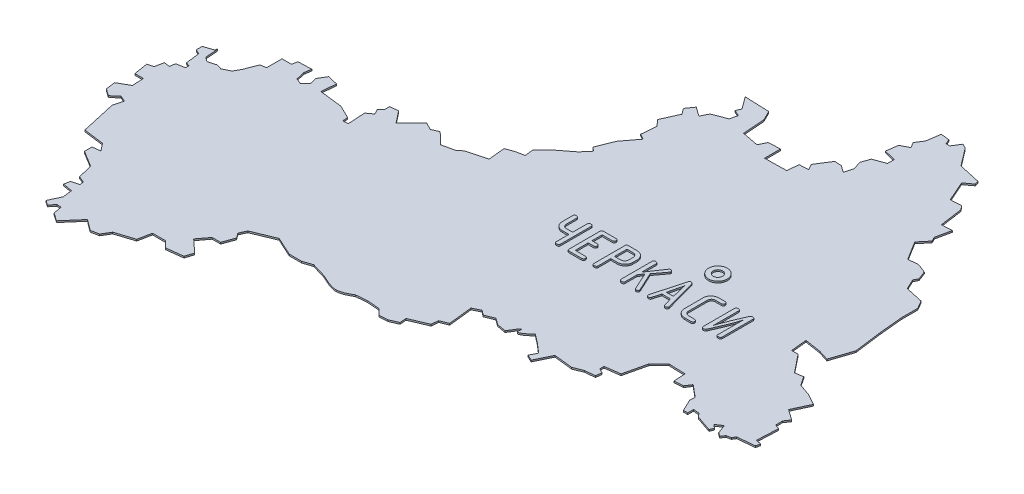
from build123d import *

# Parameters (mm, degrees)
EXTRUDE_1_DEPTH = 5
SKETCH_2_R      = 30
SKETCH_2_R_2    = 15
EXTRUDE_2_DEPTH = 10
SCALE_1_SCALE   = 0.05


with BuildPart() as part:
    # Эскиз1 → Бобышка-Вытянуть1 (new body)
    with BuildSketch(Plane(origin=(0, 0, 0), x_dir=(1, 0, 0), z_dir=(0, 1, 0))):
        with BuildLine():
            Line((-10045.36726, 2871.76464), (-10031.095, 2888.60992))
            Line((-10031.095, 2888.60992), (-10017.45774, 2887.3069))
            Line((-10017.45774, 2887.3069), (-10012.25836, 2860.07048))
            Line((-10012.25836, 2860.07048), (-9986.97012, 2842.54194))
            Line((-9986.97012, 2842.54194), (-9940.8869, 2895.76764))
            Line((-9940.8869, 2895.76764), (-9906.50546, 2869.80122))
            Line((-9906.50546, 2869.80122), (-9881.18166, 2874.99044))
            Line((-9881.18166, 2874.99044), (-9865.60384, 2900.95686))
            Line((-9865.60384, 2900.95686), (-9807.21686, 2919.74524))
            Line((-9807.21686, 2919.74524), (-9798.77136, 2961.9575))
            Line((-9798.77136, 2961.9575), (-9756.5718, 2961.9575))
            Line((-9756.5718, 2961.9575), (-9737.77326, 2941.8534))
            Line((-9737.77326, 2941.8534), (-9684.56534, 2948.33802))
            Line((-9684.56534, 2948.33802), (-9676.12492, 2974.29174))
            Line((-9676.12492, 2974.29174), (-9716.9986, 3011.92692))
            Line((-9716.9986, 3011.92692), (-9691.69512, 3045.64288))
            Line((-9691.69512, 3045.64288), (-9664.446, 3045.64288))
            Line((-9664.446, 3045.64288), (-9650.82652, 3083.306))
            Line((-9650.82652, 3083.306), (-9662.4902, 3098.88636))
            Line((-9662.4902, 3098.88636), (-9652.1143, 3120.9488))
            Line((-9652.1143, 3120.9488), (-9581.37022, 3150.15118))
            Line((-9581.37022, 3150.15118), (-9521.70054, 3122.8919))
            Line((-9521.70054, 3122.8919), (-9482.08924, 3122.8919))
            Line((-9482.08924, 3122.8919), (-9452.8894, 3132.6328))
            Line((-9452.8894, 3132.6328), (-9406.79094, 3118.99808))
            add(Edge.make_bspline(
                [(-9406.79094, 3118.99808), (-9362.7067, 3096.94326), (-9345.8284, 3098.88636)],
                knots=[0.100401606, 0.100401606, 0.100401606, 0.104417671, 0.104417671, 0.104417671], degree=2))
            add(Edge.make_bspline(
                [(-9345.8284, 3098.88636), (-9328.29224, 3100.17668), (-9303.004, 3115.74434)],
                knots=[0.104417671, 0.104417671, 0.104417671, 0.108433735, 0.108433735, 0.108433735], degree=2))
            Line((-9303.004, 3115.74434), (-9267.29414, 3118.99808))
            Line((-9267.29414, 3118.99808), (-9226.42808, 3115.74434))
            Line((-9226.42808, 3115.74434), (-9207.57112, 3096.94326))
            Line((-9207.57112, 3096.94326), (-9181.62502, 3098.88636))
            Line((-9181.62502, 3098.88636), (-9154.38352, 3110.5983))
            Line((-9154.38352, 3110.5983), (-9156.33678, 3131.3247))
            Line((-9156.33678, 3131.3247), (-9099.87004, 3155.3404))
            Line((-9099.87004, 3155.3404), (-9097.899, 3177.4003))
            Line((-9097.899, 3177.4003), (-9072.60314, 3187.79906))
            Line((-9072.60314, 3187.79906), (-9081.0461, 3264.36228))
            Line((-9081.0461, 3264.36228), (-9057.03548, 3276.04882))
            Line((-9057.03548, 3276.04882), (-9042.07996, 3264.36228))
            Line((-9042.07996, 3264.36228), (-9012.90552, 3276.04882))
            Line((-9012.90552, 3276.04882), (-8992.15118, 3261.11616))
            Line((-8992.15118, 3261.11616), (-8963.58888, 3255.93202))
            add(Edge.make_bspline(
                [(-8963.58888, 3255.93202), (-8937.625, 3300.06452), (-8940.87112, 3279.92994)],
                knots=[0.168674699, 0.168674699, 0.168674699, 0.172690763, 0.172690763, 0.172690763], degree=2))
            add(Edge.make_bspline(
                [(-8940.87112, 3279.92994), (-8944.74716, 3259.17814), (-8905.20444, 3294.8753)],
                knots=[0.172690763, 0.172690763, 0.172690763, 0.176706827, 0.176706827, 0.176706827], degree=2))
            Line((-8905.20444, 3294.8753), (-8876.63452, 3272.79762))
            Line((-8876.63452, 3272.79762), (-8847.43468, 3247.49668))
            Line((-8847.43468, 3247.49668), (-8859.11614, 3224.784))
            Line((-8859.11614, 3224.784), (-8840.28458, 3216.34358))
            Line((-8840.28458, 3216.34358), (-8815.00396, 3267.61348))
            Line((-8815.00396, 3267.61348), (-8755.2911, 3261.11616))
            Line((-8755.2911, 3261.11616), (-8726.06332, 3272.79762))
            Line((-8726.06332, 3272.79762), (-8693.6326, 3276.04882))
            Line((-8693.6326, 3276.04882), (-8691.67426, 3294.8753))
            Line((-8691.67426, 3294.8753), (-8705.93636, 3301.99492))
            Line((-8705.93636, 3301.99492), (-8705.93636, 3315.6398))
            Line((-8705.93636, 3315.6398), (-8657.93036, 3322.10664))
            Line((-8657.93036, 3322.10664), (-8641.06984, 3394.1512))
            Line((-8641.06984, 3394.1512), (-8608.6315, 3426.57938))
            Line((-8608.6315, 3426.57938), (-8555.41088, 3424.65406))
            Line((-8555.41088, 3424.65406), (-8553.46016, 3387.00872))
            Line((-8553.46016, 3387.00872), (-8524.91564, 3388.95182))
            Line((-8524.91564, 3388.95182), (-8512.58394, 3407.78338))
            Line((-8512.58394, 3407.78338), (-8473.65336, 3375.33234))
            Line((-8473.65336, 3375.33234), (-8474.95638, 3358.4515))
            Line((-8474.95638, 3358.4515), (-8456.7649, 3320.82902))
            Line((-8456.7649, 3320.82902), (-8443.16828, 3320.82902))
            Line((-8443.16828, 3320.82902), (-8443.16828, 3339.6301))
            Line((-8443.16828, 3339.6301), (-8424.31894, 3337.687))
            Line((-8424.31894, 3337.687), (-8413.95828, 3326.0157))
            Line((-8413.95828, 3326.0157), (-8362.6706, 3308.48716))
            Line((-8362.6706, 3308.48716), (-8357.45598, 3320.82902))
            Line((-8357.45598, 3320.82902), (-8369.16284, 3330.55214))
            Line((-8369.16284, 3330.55214), (-8349.05366, 3344.19702))
            Line((-8349.05366, 3344.19702), (-8338.64982, 3315.6398))
            Line((-8338.64982, 3315.6398), (-8326.99376, 3307.19684))
            Line((-8326.99376, 3307.19684), (-8318.55842, 3318.8656))
            Line((-8318.55842, 3318.8656), (-8304.26076, 3322.10664))
            Line((-8304.26076, 3322.10664), (-8297.75074, 3332.48508))
            Line((-8297.75074, 3332.48508), (-8243.26012, 3337.687))
            Line((-8243.26012, 3337.687), (-8240.014, 3351.30648))
            Line((-8240.014, 3351.30648), (-8256.91262, 3354.55768))
            Line((-8256.91262, 3354.55768), (-8253.64872, 3422.70334))
            Line((-8253.64872, 3422.70334), (-8268.58646, 3427.89256))
            Line((-8268.58646, 3427.89256), (-8268.58646, 3450.60016))
            Line((-8268.58646, 3450.60016), (-8256.91262, 3467.47084))
            Line((-8256.91262, 3467.47084), (-8290.67176, 3491.48654))
            Line((-8290.67176, 3491.48654), (-8265.3378, 3545.98986))
            Line((-8265.3378, 3545.98986), (-8299.71162, 3564.81126))
            Line((-8299.71162, 3564.81126), (-8338.64982, 3578.43582))
            Line((-8338.64982, 3578.43582), (-8357.45598, 3607.01336))
            Line((-8357.45598, 3607.01336), (-8382.80518, 3602.4566))
            Line((-8382.80518, 3602.4566), (-8428.86046, 3660.19842))
            Line((-8428.86046, 3660.19842), (-8449.63512, 3660.19842))
            Line((-8449.63512, 3660.19842), (-8454.81418, 3711.48864))
            Line((-8454.81418, 3711.48864), (-8401.58594, 3703.04568))
            Line((-8401.58594, 3703.04568), (-8369.16284, 3692.6393))
            Line((-8369.16284, 3692.6393), (-8345.79992, 3762.74076))
            Line((-8345.79992, 3762.74076), (-8357.45598, 3851.64584))
            Line((-8357.45598, 3851.64584), (-8364.6391, 3926.27866))
            Line((-8364.6391, 3926.27866), (-8364.6391, 3979.50436))
            Line((-8364.6391, 3979.50436), (-8379.587, 4004.80276))
            Line((-8379.587, 4004.80276), (-8435.99278, 4017.12684))
            Line((-8435.99278, 4017.12684), (-8451.57568, 4049.58042))
            Line((-8451.57568, 4049.58042), (-8444.43574, 4063.2126))
            Line((-8444.43574, 4063.2126), (-8454.81418, 4090.46172))
            Line((-8454.81418, 4090.46172), (-8485.31958, 4102.13048))
            Line((-8485.31958, 4102.13048), (-8516.47014, 4098.89198))
            Line((-8516.47014, 4098.89198), (-8553.46016, 4158.58452))
            Line((-8553.46016, 4158.58452), (-8528.16176, 4189.08992))
            Line((-8528.16176, 4189.08992), (-8535.3271, 4202.7094))
            Line((-8535.3271, 4202.7094), (-8524.91564, 4250.75096))
            Line((-8524.91564, 4250.75096), (-8558.6824, 4248.7977))
            Line((-8558.6824, 4248.7977), (-8569.03544, 4322.13766))
            Line((-8569.03544, 4322.13766), (-8579.41388, 4334.45666))
            Line((-8579.41388, 4334.45666), (-8613.82072, 4332.51102))
            Line((-8613.82072, 4332.51102), (-8642.38302, 4397.3877))
            Line((-8642.38302, 4397.3877), (-8617.05668, 4416.23196))
            Line((-8617.05668, 4416.23196), (-8620.28756, 4427.9058))
            Line((-8620.28756, 4427.9058), (-8690.40426, 4443.48108))
            Line((-8690.40426, 4443.48108), (-8733.21342, 4499.93766))
            Line((-8733.21342, 4499.93766), (-8747.4679, 4507.07506))
            Line((-8747.4679, 4507.07506), (-8763.71628, 4481.10356))
            Line((-8763.71628, 4481.10356), (-8775.39774, 4481.10356))
            Line((-8775.39774, 4481.10356), (-8782.52244, 4496.69154))
            Line((-8782.52244, 4496.69154), (-8809.78934, 4499.93766))
            Line((-8809.78934, 4499.93766), (-8816.28158, 4455.82294))
            Line((-8816.28158, 4455.82294), (-8831.83146, 4431.81486))
            Line((-8831.83146, 4431.81486), (-8821.48858, 4414.27616))
            Line((-8821.48858, 4414.27616), (-8847.43468, 4400.6389))
            Line((-8847.43468, 4400.6389), (-8852.65692, 4363.65396))
            Line((-8852.65692, 4363.65396), (-8815.00396, 4354.576))
            Line((-8815.00396, 4354.576), (-8815.00396, 4332.51102))
            Line((-8815.00396, 4332.51102), (-8852.65692, 4318.88138))
            Line((-8852.65692, 4318.88138), (-8862.3521, 4291.63734))
            Line((-8862.3521, 4291.63734), (-8853.90152, 4264.37044))
            Line((-8853.90152, 4264.37044), (-8861.05924, 4237.12132))
            Line((-8861.05924, 4237.12132), (-8883.0912, 4252.67882))
            Line((-8883.0912, 4252.67882), (-8905.20444, 4253.98692))
            Line((-8905.20444, 4253.98692), (-8934.39666, 4207.92402))
            Line((-8934.39666, 4207.92402), (-8924.00044, 4189.08992))
            Line((-8924.00044, 4189.08992), (-8953.22822, 4187.80214))
            Line((-8953.22822, 4187.80214), (-8956.45656, 4151.4522))
            Line((-8956.45656, 4151.4522), (-9026.5123, 4150.15426))
            Line((-9026.5123, 4150.15426), (-9026.5123, 4201.43178))
            Line((-9026.5123, 4201.43178), (-9064.15764, 4199.48614))
            Line((-9064.15764, 4199.48614), (-9075.87466, 4175.4679))
            Line((-9075.87466, 4175.4679), (-9129.06226, 4185.83872))
            Line((-9129.06226, 4185.83872), (-9134.2591, 4255.92494))
            Line((-9134.2591, 4255.92494), (-9149.18668, 4286.43542))
            Line((-9149.18668, 4286.43542), (-9227.7057, 4289.69932))
            Line((-9227.7057, 4289.69932), (-9199.15356, 4250.75096))
            Line((-9199.15356, 4250.75096), (-9205.65342, 4235.1706))
            Line((-9205.65342, 4235.1706), (-9186.79646, 4226.7378))
            Line((-9186.79646, 4226.7378), (-9192.02124, 4202.7094))
            Line((-9192.02124, 4202.7094), (-9236.13342, 4185.83872))
            Line((-9236.13342, 4185.83872), (-9248.45242, 4161.83572))
            Line((-9248.45242, 4161.83572), (-9277.66242, 4182.6053))
            Line((-9277.66242, 4182.6053), (-9294.51532, 4158.58452))
            Line((-9294.51532, 4158.58452), (-9280.92632, 4139.78852))
            Line((-9280.92632, 4139.78852), (-9304.92932, 4086.5552))
            Line((-9304.92932, 4086.5552), (-9287.4465, 4066.44602))
            Line((-9287.4465, 4066.44602), (-9291.27936, 4018.40954))
            Line((-9291.27936, 4018.40954), (-9273.7686, 4008.6788))
            Line((-9273.7686, 4008.6788), (-9310.14394, 3960.67026))
            Line((-9310.14394, 3960.67026), (-9332.214, 3906.16186))
            Line((-9332.214, 3906.16186), (-9319.86706, 3895.77072))
            Line((-9319.86706, 3895.77072), (-9341.91934, 3869.817))
            Line((-9341.91934, 3869.817), (-9387.95938, 3834.12492))
            Line((-9387.95938, 3834.12492), (-9420.43836, 3801.6688))
            Line((-9420.43836, 3801.6688), (-9417.19986, 3774.43492))
            Line((-9417.19986, 3774.43492), (-9444.45406, 3769.23046))
            Line((-9444.45406, 3769.23046), (-9470.41794, 3759.49464))
            Line((-9470.41794, 3759.49464), (-9465.21348, 3706.29434))
            Line((-9465.21348, 3706.29434), (-9528.18008, 3689.41858))
            Line((-9528.18008, 3689.41858), (-9543.73758, 3677.0818))
            Line((-9543.73758, 3677.0818), (-9582.69102, 3668.62868))
            Line((-9582.69102, 3668.62868), (-9619.6658, 3704.34108))
            Line((-9619.6658, 3704.34108), (-9641.7257, 3694.59256))
            Line((-9641.7257, 3694.59256), (-9664.446, 3706.29434))
            Line((-9664.446, 3706.29434), (-9713.7601, 3656.97008))
            Line((-9713.7601, 3656.97008), (-9744.2528, 3695.90574))
            Line((-9744.2528, 3695.90574), (-9770.21922, 3692.6393))
            Line((-9770.21922, 3692.6393), (-9770.21922, 3675.7864))
            Line((-9770.21922, 3675.7864), (-9781.89306, 3665.40034))
            Line((-9781.89306, 3665.40034), (-9773.46534, 3648.52966))
            Line((-9773.46534, 3648.52966), (-9792.26134, 3634.9051))
            Line((-9792.26134, 3634.9051), (-9789.033, 3579.73122))
            Line((-9789.033, 3579.73122), (-9805.92146, 3578.43582))
            Line((-9805.92146, 3578.43582), (-9807.21686, 3595.32682))
            Line((-9807.21686, 3595.32682), (-9850.04634, 3616.09386))
            Line((-9850.04634, 3616.09386), (-9922.07566, 3624.52158))
            Line((-9922.07566, 3624.52158), (-9918.16914, 3670.58956))
            Line((-9918.16914, 3670.58956), (-9950.62018, 3679.03252))
            Line((-9950.62018, 3679.03252), (-9966.20562, 3653.0661))
            Line((-9966.20562, 3653.0661), (-9961.0037, 3629.71588))
            Line((-9961.0037, 3629.71588), (-9977.882, 3614.12536))
            Line((-9977.882, 3614.12536), (-9995.39784, 3621.28054))
            Line((-9995.39784, 3621.28054), (-10001.89516, 3649.81998))
            Line((-10001.89516, 3649.81998), (-9998.64904, 3671.88496))
            Line((-9998.64904, 3671.88496), (-10041.46836, 3670.58956))
            Line((-10041.46836, 3670.58956), (-10044.72718, 3653.0661))
            Line((-10044.72718, 3653.0661), (-10075.21988, 3653.0661))
            Line((-10075.21988, 3653.0661), (-10075.21988, 3603.752))
            Line((-10075.21988, 3603.752), (-10094.04128, 3600.49826))
            Line((-10094.04128, 3600.49826), (-10109.59624, 3559.63982))
            Line((-10109.59624, 3559.63982), (-10121.30056, 3538.855))
            Line((-10121.30056, 3538.855), (-10145.3188, 3527.18116))
            Line((-10145.3188, 3527.18116), (-10162.16154, 3532.378))
            Line((-10162.16154, 3532.378), (-10188.12796, 3525.22028))
            Line((-10188.12796, 3525.22028), (-10201.7576, 3535.62158))
            Line((-10201.7576, 3535.62158), (-10205.00626, 3576.49018))
            Line((-10205.00626, 3576.49018), (-10206.94936, 3576.49018))
            Line((-10206.94936, 3576.49018), (-10206.94936, 3570.00048))
            Line((-10206.94936, 3570.00048), (-10237.46746, 3559.63982))
            Line((-10237.46746, 3559.63982), (-10237.46746, 3540.8108))
            Line((-10237.46746, 3540.8108), (-10222.51702, 3533.67848))
            Line((-10222.51702, 3533.67848), (-10217.33288, 3489.5409))
            Line((-10217.33288, 3489.5409), (-10205.00626, 3484.36438))
            Line((-10205.00626, 3484.36438), (-10205.00626, 3473.96816))
            Line((-10205.00626, 3473.96816), (-10232.27062, 3468.77132))
            Line((-10232.27062, 3468.77132), (-10234.20356, 3451.90318))
            Line((-10234.20356, 3451.90318), (-10253.02242, 3453.84628))
            Line((-10253.02242, 3453.84628), (-10258.21418, 3426.57938))
            Line((-10258.21418, 3426.57938), (-10277.02796, 3421.39016))
            Line((-10277.02796, 3421.39016), (-10269.88548, 3376.62012))
            Line((-10269.88548, 3376.62012), (-10242.66176, 3376.62012))
            Line((-10242.66176, 3376.62012), (-10240.68818, 3339.6301))
            Line((-10240.68818, 3339.6301), (-10277.02796, 3318.8656))
            Line((-10277.02796, 3318.8656), (-10273.15192, 3288.36528))
            Line((-10273.15192, 3288.36528), (-10251.06662, 3272.79762))
            Line((-10251.06662, 3272.79762), (-10229.02196, 3291.62918))
            Line((-10229.02196, 3291.62918), (-10210.18278, 3283.16336))
            Line((-10210.18278, 3283.16336), (-10218.63336, 3252.02042))
            Line((-10218.63336, 3252.02042), (-10193.3248, 3139.76512))
            Line((-10193.3248, 3139.76512), (-10128.43034, 3131.3247))
            Line((-10128.43034, 3131.3247), (-10109.59624, 3107.32424))
            Line((-10109.59624, 3107.32424), (-10134.91242, 3104.0705))
            Line((-10134.91242, 3104.0705), (-10134.91242, 3080.0548))
            Line((-10134.91242, 3080.0548), (-10084.30292, 3048.90678))
            Line((-10084.30292, 3048.90678), (-10071.9636, 3001.5307))
            Line((-10071.9636, 3001.5307), (-10051.8468, 2993.10806))
            Line((-10051.8468, 2993.10806), (-10049.90878, 2980.7789))
            Line((-10049.90878, 2980.7789), (-10073.92956, 2974.29174))
            Line((-10073.92956, 2974.29174), (-10077.16806, 2955.46018))
            Line((-10077.16806, 2955.46018), (-10046.68806, 2950.28874))
            Line((-10046.68806, 2950.28874), (-10042.76884, 2919.74524))
            Line((-10042.76884, 2919.74524), (-10060.28722, 2882.1253))
            Line((-10060.28722, 2882.1253), (-10045.36726, 2871.76464))
        make_face()
    extrude(amount=EXTRUDE_1_DEPTH)

    # Эскиз2 → Бобышка-Вытянуть2 (add)
    # profile 1 of 8: a face of its own
    with BuildSketch(Plane(origin=(0, 0, 0), x_dir=(1, 0, 0), z_dir=(0, 1, 0))):
        with Locations(Location((-8776.080105854, 3750.563843314, 0), (0, 0, 270))):
            Circle(SKETCH_2_R)
        with Locations(Location((-8776.080105854, 3750.563843314, 0), (0, 0, 270))):
            Circle(SKETCH_2_R_2, mode=Mode.SUBTRACT)
    # profile 2 of 8: a face of its own
    with BuildSketch(Plane(origin=(0, 0, 0), x_dir=(1, 0, 0), z_dir=(0, 1, 0))):
        with BuildLine():
            add(Edge.make_bspline(
                [(-9110.080888002, 3579.8148846), (-9110.099329144, 3579.393630094), (-9110.134223129, 3578.596540129), (-9110.502951401, 3577.482905039), (-9111.085298144, 3576.527090292), (-9111.939885579, 3575.764272887), (-9113.014481098, 3575.183463542), (-9114.312470578, 3574.766994976), (-9115.841908779, 3574.554423279), (-9116.932084932, 3574.516349473), (-9117.513320435, 3574.496050141)],
                knots=[0, 0, 0, 0, 0.969647621, 1.834749252, 2.678145047, 3.526077294, 4.446504318, 5.481227067, 6.657097526, 8, 8, 8, 8], degree=3))
            add(Edge.make_bspline(
                [(-9117.513320435, 3574.496050141), (-9117.978578859, 3574.516327691), (-9118.853540183, 3574.554461494), (-9120.085298367, 3574.769739262), (-9121.129242868, 3575.191909424), (-9121.992446687, 3575.781302453), (-9122.671902898, 3576.552062279), (-9123.127508239, 3577.501213571), (-9123.417522334, 3578.605738174), (-9123.444761621, 3579.394743756), (-9123.459266381, 3579.8148846)],
                knots=[0, 0, 0, 0, 1.22289028, 2.299757822, 3.266537475, 4.157864275, 5.022578284, 5.932048079, 6.898827733, 8, 8, 8, 8], degree=3))
            Line((-9123.459266381, 3579.8148846), (-9123.459266381, 3620.577131222))
            Line((-9123.459266381, 3620.577131222), (-9145.059773137, 3620.577131222))
            add(Edge.make_bspline(
                [(-9145.059773137, 3620.577131222), (-9145.896820366, 3620.601201146), (-9147.54631337, 3620.648633561), (-9149.969006155, 3620.970858223), (-9152.289560569, 3621.543599386), (-9154.523858996, 3622.296710524), (-9156.654874129, 3623.309163971), (-9158.679370255, 3624.548769721), (-9160.612611476, 3625.997849721), (-9162.444428446, 3627.633770895), (-9164.08849355, 3629.449729446), (-9165.552076832, 3631.37124407), (-9166.780181694, 3633.388089463), (-9167.791510951, 3635.504700287), (-9168.58485603, 3637.713186007), (-9169.138763523, 3640.018485273), (-9169.471535695, 3642.415673307), (-9169.517109347, 3644.042415154), (-9169.540347462, 3644.871894735)],
                knots=[0, 0, 0, 0, 1.046542739, 2.062326793, 3.048388737, 4.031023869, 5.005279697, 5.991389151, 6.9942227, 8.022384199, 9.057041184, 10.052136522, 11.038245977, 12.003758709, 12.980463927, 13.966525871, 14.96312665, 16, 16, 16, 16], degree=3))
            Line((-9169.540347462, 3644.871894735), (-9169.540347462, 3679.200442032))
            add(Edge.make_bspline(
                [(-9169.540347462, 3679.200442032), (-9169.523914666, 3679.612344388), (-9169.492484565, 3680.400167246), (-9169.219202715, 3681.502992347), (-9168.745266601, 3682.443850148), (-9168.074371409, 3683.211189037), (-9167.210074365, 3683.800075121), (-9166.166456743, 3684.222396862), (-9164.934597872, 3684.43762794), (-9164.059651819, 3684.475768824), (-9163.594401516, 3684.496050141)],
                knots=[0, 0, 0, 0, 1.083429305, 2.072215321, 2.965634013, 3.832377457, 4.725796149, 5.694844779, 6.774239667, 8, 8, 8, 8], degree=3))
            add(Edge.make_bspline(
                [(-9163.594401516, 3684.496050141), (-9163.012217405, 3684.489812241), (-9161.918708576, 3684.478095674), (-9160.401428678, 3684.208372728), (-9159.089932442, 3683.840727083), (-9158.029638838, 3683.247297579), (-9157.166872958, 3682.514862062), (-9156.584597564, 3681.579585977), (-9156.21502849, 3680.489175447), (-9156.180322212, 3679.706981627), (-9156.161969083, 3679.293347438)],
                knots=[0, 0, 0, 0, 1.353106154, 2.541521659, 3.579288285, 4.507284885, 5.350131461, 6.185231121, 7.040326791, 8, 8, 8, 8], degree=3))
            Line((-9156.161969083, 3679.293347438), (-9156.161969083, 3645.800948789))
            add(Edge.make_bspline(
                [(-9156.161969083, 3645.800948789), (-9156.121479599, 3644.851573034), (-9156.043276337, 3643.017904802), (-9155.325824868, 3640.420411695), (-9154.167087109, 3638.098277387), (-9152.55881126, 3636.123159157), (-9150.687861294, 3634.511639929), (-9148.649693695, 3633.350978492), (-9146.512849927, 3632.597848898), (-9145.034851207, 3632.512063647), (-9144.293303543, 3632.469023113)],
                knots=[0, 0, 0, 0, 1.148644306, 2.218544726, 3.238301574, 4.272931153, 5.284625871, 6.213417378, 7.103628338, 8, 8, 8, 8], degree=3))
            Line((-9144.293303543, 3632.469023113), (-9123.459266381, 3632.469023113))
            Line((-9123.459266381, 3632.469023113), (-9123.459266381, 3679.293347438))
            add(Edge.make_bspline(
                [(-9123.459266381, 3679.293347438), (-9123.4448574, 3679.705850897), (-9123.417822767, 3680.479804286), (-9123.127163535, 3681.560908673), (-9122.672434886, 3682.490006827), (-9121.983497088, 3683.231973361), (-9121.135694203, 3683.83147841), (-9120.075977426, 3684.206752136), (-9118.858691815, 3684.477506715), (-9117.979695659, 3684.489622031), (-9117.513320435, 3684.496050141)],
                knots=[0, 0, 0, 0, 1.091529518, 2.047965782, 2.948064081, 3.805939007, 4.706037306, 5.674741692, 6.76627121, 8, 8, 8, 8], degree=3))
            add(Edge.make_bspline(
                [(-9117.513320435, 3684.496050141), (-9116.932084932, 3684.475750808), (-9115.841908779, 3684.437677002), (-9114.312470578, 3684.225105305), (-9113.014481098, 3683.808636739), (-9111.939885579, 3683.227827394), (-9111.085298144, 3682.465009989), (-9110.502951401, 3681.509195242), (-9110.134223129, 3680.395560152), (-9110.099329144, 3679.598470187), (-9110.080888002, 3679.177215681)],
                knots=[0, 0, 0, 0, 1.342902474, 2.518772933, 3.553495682, 4.473922706, 5.321854953, 6.165250748, 7.030352379, 8, 8, 8, 8], degree=3))
            Line((-9110.080888002, 3679.177215681), (-9110.080888002, 3579.8148846))
        make_face()
    # profile 3 of 8: a face of its own
    with BuildSketch(Plane(origin=(0, 0, 0), x_dir=(1, 0, 0), z_dir=(0, 1, 0))):
        with BuildLine():
            Line((-9069.053860975, 3628.009563654), (-9069.053860975, 3586.387942032))
            Line((-9069.053860975, 3586.387942032), (-9037.419570435, 3586.387942032))
            add(Edge.make_bspline(
                [(-9037.419570435, 3586.387942032), (-9036.884182053, 3586.372080172), (-9035.874814518, 3586.342175811), (-9034.466115936, 3586.072258192), (-9033.268018758, 3585.599860408), (-9032.265437339, 3584.953753996), (-9031.498918661, 3584.081427713), (-9030.950693138, 3583.032149849), (-9030.660781434, 3581.788606097), (-9030.615158837, 3580.9079102), (-9030.591023137, 3580.441996086)],
                knots=[0, 0, 0, 0, 1.239032302, 2.335947183, 3.301339876, 4.206248485, 5.069721959, 5.959770044, 6.920658157, 8, 8, 8, 8], degree=3))
            add(Edge.make_bspline(
                [(-9030.591023137, 3580.441996086), (-9030.615158837, 3579.976081973), (-9030.660781434, 3579.095386076), (-9030.950693138, 3577.851842324), (-9031.498918661, 3576.80256446), (-9032.265437339, 3575.930238177), (-9033.268018758, 3575.284131765), (-9034.466115936, 3574.811733981), (-9035.874814518, 3574.541816362), (-9036.884182053, 3574.511912001), (-9037.419570435, 3574.496050141)],
                knots=[0, 0, 0, 0, 1.079341843, 2.040229956, 2.930278041, 3.793751515, 4.698660124, 5.664052817, 6.760967698, 8, 8, 8, 8], degree=3))
            Line((-9037.419570435, 3574.496050141), (-9076.486293408, 3574.496050141))
            add(Edge.make_bspline(
                [(-9076.486293408, 3574.496050141), (-9076.951551832, 3574.516327691), (-9077.826513156, 3574.554461494), (-9079.05827134, 3574.769739262), (-9080.102215841, 3575.191909424), (-9080.96541966, 3575.781302453), (-9081.644875871, 3576.552062279), (-9082.100481212, 3577.501213571), (-9082.390495307, 3578.605738174), (-9082.417734594, 3579.394743756), (-9082.432239354, 3579.8148846)],
                knots=[0, 0, 0, 0, 1.22289028, 2.299757822, 3.266537475, 4.157864275, 5.022578284, 5.932048079, 6.898827733, 8, 8, 8, 8], degree=3))
            Line((-9082.432239354, 3579.8148846), (-9082.432239354, 3679.177215681))
            add(Edge.make_bspline(
                [(-9082.432239354, 3679.177215681), (-9082.417734594, 3679.597356525), (-9082.390495307, 3680.386362107), (-9082.100481212, 3681.49088671), (-9081.644875871, 3682.440038002), (-9080.96541966, 3683.210797828), (-9080.102215841, 3683.800190857), (-9079.05827134, 3684.222361019), (-9077.826513156, 3684.437638787), (-9076.951551832, 3684.47577259), (-9076.486293408, 3684.496050141)],
                knots=[0, 0, 0, 0, 1.101172267, 2.067951921, 2.977421716, 3.842135725, 4.733462525, 5.700242178, 6.77710972, 8, 8, 8, 8], degree=3))
            Line((-9076.486293408, 3684.496050141), (-9037.419570435, 3684.496050141))
            add(Edge.make_bspline(
                [(-9037.419570435, 3684.496050141), (-9036.884182053, 3684.48018828), (-9035.874814518, 3684.450283919), (-9034.466115936, 3684.1803663), (-9033.268018758, 3683.707968516), (-9032.265437339, 3683.061862104), (-9031.498918661, 3682.189535821), (-9030.950693138, 3681.140257957), (-9030.660781434, 3679.896714205), (-9030.615158837, 3679.016018308), (-9030.591023137, 3678.550104195)],
                knots=[0, 0, 0, 0, 1.239032302, 2.335947183, 3.301339876, 4.206248485, 5.069721959, 5.959770044, 6.920658157, 8, 8, 8, 8], degree=3))
            add(Edge.make_bspline(
                [(-9030.591023137, 3678.550104195), (-9030.615158837, 3678.084190081), (-9030.660781434, 3677.203494184), (-9030.950693138, 3675.959950432), (-9031.498918661, 3674.910672568), (-9032.265437339, 3674.038346285), (-9033.268018758, 3673.392239873), (-9034.466115936, 3672.919842089), (-9035.874814518, 3672.649924471), (-9036.884182053, 3672.62002011), (-9037.419570435, 3672.604158249)],
                knots=[0, 0, 0, 0, 1.079341843, 2.040229956, 2.930278041, 3.793751515, 4.698660124, 5.664052817, 6.760967698, 8, 8, 8, 8], degree=3))
            Line((-9037.419570435, 3672.604158249), (-9069.053860975, 3672.604158249))
            Line((-9069.053860975, 3672.604158249), (-9069.053860975, 3639.901455546))
            Line((-9069.053860975, 3639.901455546), (-9052.795415029, 3639.901455546))
            add(Edge.make_bspline(
                [(-9052.795415029, 3639.901455546), (-9052.260026648, 3639.885593685), (-9051.250659112, 3639.855689324), (-9049.841960531, 3639.585771705), (-9048.643863353, 3639.113373922), (-9047.641281934, 3638.46726751), (-9046.874763255, 3637.594941226), (-9046.326537733, 3636.545663362), (-9046.036626029, 3635.302119611), (-9045.991003432, 3634.421423714), (-9045.966867732, 3633.9555096)],
                knots=[0, 0, 0, 0, 1.239032302, 2.335947183, 3.301339876, 4.206248485, 5.069721959, 5.959770044, 6.920658157, 8, 8, 8, 8], degree=3))
            add(Edge.make_bspline(
                [(-9045.966867732, 3633.9555096), (-9045.991003432, 3633.489595486), (-9046.036626029, 3632.608899589), (-9046.326537733, 3631.365355838), (-9046.874763255, 3630.316077974), (-9047.641281934, 3629.44375169), (-9048.643863353, 3628.797645278), (-9049.841960531, 3628.325247495), (-9051.250659112, 3628.055329876), (-9052.260026648, 3628.025425515), (-9052.795415029, 3628.009563654)],
                knots=[0, 0, 0, 0, 1.079341843, 2.040229956, 2.930278041, 3.793751515, 4.698660124, 5.664052817, 6.760967698, 8, 8, 8, 8], degree=3))
            Line((-9052.795415029, 3628.009563654), (-9069.053860975, 3628.009563654))
        make_face()
    # profile 4 of 8: a face of its own
    with BuildSketch(Plane(origin=(0, 0, 0), x_dir=(1, 0, 0), z_dir=(0, 1, 0))):
        with BuildLine():
            Line((-8989.3781853, 3620.577131222), (-8989.3781853, 3579.8148846))
            add(Edge.make_bspline(
                [(-8989.3781853, 3579.8148846), (-8989.396626441, 3579.393630094), (-8989.431520427, 3578.596540129), (-8989.800248698, 3577.482905039), (-8990.382595442, 3576.527090292), (-8991.237182876, 3575.764272887), (-8992.311778396, 3575.183463542), (-8993.609767875, 3574.766994976), (-8995.139206076, 3574.554423279), (-8996.229382229, 3574.516349473), (-8996.810617732, 3574.496050141)],
                knots=[0, 0, 0, 0, 0.969647621, 1.834749252, 2.678145047, 3.526077294, 4.446504318, 5.481227067, 6.657097526, 8, 8, 8, 8], degree=3))
            add(Edge.make_bspline(
                [(-8996.810617732, 3574.496050141), (-8997.275876156, 3574.516327691), (-8998.150837481, 3574.554461494), (-8999.382595664, 3574.769739262), (-9000.426540166, 3575.191909424), (-9001.289743984, 3575.781302453), (-9001.969200196, 3576.552062279), (-9002.424805536, 3577.501213571), (-9002.714819632, 3578.605738174), (-9002.742058918, 3579.394743756), (-9002.756563678, 3579.8148846)],
                knots=[0, 0, 0, 0, 1.22289028, 2.299757822, 3.266537475, 4.157864275, 5.022578284, 5.932048079, 6.898827733, 8, 8, 8, 8], degree=3))
            Line((-9002.756563678, 3579.8148846), (-9002.756563678, 3679.177215681))
            add(Edge.make_bspline(
                [(-9002.756563678, 3679.177215681), (-9002.740181736, 3679.597014359), (-9002.70949056, 3680.383497135), (-9002.445525346, 3681.484036824), (-9002.039053265, 3682.427304734), (-9001.435706162, 3683.208416004), (-9000.644124022, 3683.793284403), (-8999.695324405, 3684.22019682), (-8998.569857032, 3684.438888696), (-8997.771460656, 3684.47614278), (-8997.344823813, 3684.496050141)],
                knots=[0, 0, 0, 0, 1.157077194, 2.167756429, 3.10506564, 3.97280776, 4.857486845, 5.794796055, 6.821611322, 8, 8, 8, 8], degree=3))
            Line((-8997.344823813, 3684.496050141), (-8969.891276516, 3684.496050141))
            add(Edge.make_bspline(
                [(-8969.891276516, 3684.496050141), (-8968.960822124, 3684.475910118), (-8967.139590041, 3684.43648889), (-8964.469936843, 3684.062519416), (-8961.907582481, 3683.53470137), (-8959.479055673, 3682.689373405), (-8957.139062857, 3681.692523739), (-8954.953962341, 3680.379607058), (-8952.847991026, 3678.909196454), (-8950.922987826, 3677.182333215), (-8949.137773441, 3675.346919974), (-8947.583634282, 3673.400688736), (-8946.266473753, 3671.375630481), (-8945.167201541, 3669.291215687), (-8944.320844918, 3667.117391892), (-8943.752309161, 3664.860813203), (-8943.355702606, 3662.545582545), (-8943.316691394, 3660.96943144), (-8943.297104218, 3660.178060276)],
                knots=[0, 0, 0, 0, 1.115359705, 2.183157925, 3.228715987, 4.24774915, 5.262329495, 6.273717254, 7.299288291, 8.338890594, 9.370038504, 10.367862649, 11.320905581, 12.263804873, 13.189908176, 14.111156383, 15.051628764, 16, 16, 16, 16], degree=3))
            Line((-8943.297104218, 3660.178060276), (-8943.297104218, 3644.825442032))
            add(Edge.make_bspline(
                [(-8943.297104218, 3644.825442032), (-8943.318893041, 3644.0344318), (-8943.362045554, 3642.467845109), (-8943.723146868, 3640.155921431), (-8944.302889587, 3637.913473334), (-8945.123399416, 3635.742754303), (-8946.167511122, 3633.644769819), (-8947.469889979, 3631.634583347), (-8948.971557225, 3629.679216431), (-8950.714331893, 3627.846604794), (-8952.584766782, 3626.117687562), (-8954.651922812, 3624.66978962), (-8956.795925469, 3623.385002639), (-8959.088737934, 3622.377375891), (-8961.482774946, 3621.543517111), (-8964.012173481, 3621.007271164), (-8966.64421221, 3620.638361131), (-8968.442159588, 3620.597780995), (-8969.357070435, 3620.577131222)],
                knots=[0, 0, 0, 0, 0.959067182, 1.899421552, 2.831059805, 3.764258791, 4.709244439, 5.667943704, 6.665417502, 7.695258647, 8.732566372, 9.748959613, 10.750800674, 11.759659972, 12.7812896, 13.820296438, 14.890827142, 16, 16, 16, 16], degree=3))
            Line((-8969.357070435, 3620.577131222), (-8989.3781853, 3620.577131222))
        make_face()
        with BuildLine():
            Line((-8989.3781853, 3632.469023113), (-8970.100313678, 3632.469023113))
            add(Edge.make_bspline(
                [(-8970.100313678, 3632.469023113), (-8969.212178664, 3632.509039394), (-8967.466934422, 3632.587674042), (-8964.969973599, 3633.348062404), (-8962.654128742, 3634.531570471), (-8960.604875237, 3636.172284423), (-8958.85935922, 3638.112057242), (-8957.596260798, 3640.328774537), (-8956.821986728, 3642.738740126), (-8956.724714537, 3644.417220774), (-8956.675482597, 3645.266742708)],
                knots=[0, 0, 0, 0, 1.033886494, 2.031655573, 3.017574438, 4.053235711, 5.077365722, 6.044435782, 7.010238993, 8, 8, 8, 8], degree=3))
            Line((-8956.675482597, 3645.266742708), (-8956.675482597, 3659.7367596))
            add(Edge.make_bspline(
                [(-8956.675482597, 3659.7367596), (-8956.725292078, 3660.585944716), (-8956.82370537, 3662.263759881), (-8957.590756793, 3664.682348442), (-8958.892457324, 3666.887972098), (-8960.623624264, 3668.846158159), (-8962.659689736, 3670.529896635), (-8964.977070526, 3671.717439798), (-8967.473603805, 3672.488433777), (-8969.211915981, 3672.565018276), (-8970.100313678, 3672.604158249)],
                knots=[0, 0, 0, 0, 0.988107596, 1.952297418, 2.922249424, 3.951448995, 4.983962972, 5.98039188, 6.967840629, 8, 8, 8, 8], degree=3))
            Line((-8970.100313678, 3672.604158249), (-8989.3781853, 3672.604158249))
            Line((-8989.3781853, 3672.604158249), (-8989.3781853, 3632.469023113))
        make_face(mode=Mode.SUBTRACT)
    # profile 5 of 8: a face of its own
    with BuildSketch(Plane(origin=(0, 0, 0), x_dir=(1, 0, 0), z_dir=(0, 1, 0))):
        with BuildLine():
            Line((-8902.270077191, 3617.232536627), (-8902.270077191, 3579.861337303))
            add(Edge.make_bspline(
                [(-8902.270077191, 3579.861337303), (-8902.289598943, 3579.440374158), (-8902.326880227, 3578.636447985), (-8902.68671292, 3577.512372522), (-8903.274091132, 3576.54893237), (-8904.135220589, 3575.790865708), (-8905.196026986, 3575.177567215), (-8906.502935991, 3574.769256492), (-8908.030706201, 3574.553729054), (-8909.121137883, 3574.516108055), (-8909.702509624, 3574.496050141)],
                knots=[0, 0, 0, 0, 0.966526808, 1.845805764, 2.686487088, 3.531690263, 4.457941251, 5.489333743, 6.661419661, 8, 8, 8, 8], degree=3))
            add(Edge.make_bspline(
                [(-8909.702509624, 3574.496050141), (-8910.167768048, 3574.516327691), (-8911.042729373, 3574.554461494), (-8912.274487556, 3574.769739262), (-8913.318432057, 3575.191909424), (-8914.181635876, 3575.781302453), (-8914.861092087, 3576.552062279), (-8915.316697428, 3577.501213571), (-8915.606711523, 3578.605738174), (-8915.63395081, 3579.394743756), (-8915.64845557, 3579.8148846)],
                knots=[0, 0, 0, 0, 1.22289028, 2.299757822, 3.266537475, 4.157864275, 5.022578284, 5.932048079, 6.898827733, 8, 8, 8, 8], degree=3))
            Line((-8915.64845557, 3579.8148846), (-8915.64845557, 3679.177215681))
            add(Edge.make_bspline(
                [(-8915.64845557, 3679.177215681), (-8915.63395081, 3679.597356525), (-8915.606711523, 3680.386362107), (-8915.316697428, 3681.49088671), (-8914.861092087, 3682.440038002), (-8914.181635876, 3683.210797828), (-8913.318432057, 3683.800190857), (-8912.274487556, 3684.222361019), (-8911.042729373, 3684.437638787), (-8910.167768048, 3684.47577259), (-8909.702509624, 3684.496050141)],
                knots=[0, 0, 0, 0, 1.101172267, 2.067951921, 2.977421716, 3.842135725, 4.733462525, 5.700242178, 6.77710972, 8, 8, 8, 8], degree=3))
            add(Edge.make_bspline(
                [(-8909.702509624, 3684.496050141), (-8909.121421964, 3684.475493302), (-8908.031523107, 3684.436936512), (-8906.500274828, 3684.227517532), (-8905.21151177, 3683.80228907), (-8904.121928147, 3683.255307998), (-8903.283669398, 3682.489010037), (-8902.685441276, 3681.552525581), (-8902.327163853, 3680.44854916), (-8902.289702235, 3679.659995106), (-8902.270077191, 3679.246894735)],
                knots=[0, 0, 0, 0, 1.349898262, 2.531894363, 3.572007453, 4.488635547, 5.340985057, 6.173587819, 7.043196157, 8, 8, 8, 8], degree=3))
            Line((-8902.270077191, 3679.246894735), (-8902.270077191, 3631.772232573))
            Line((-8902.270077191, 3631.772232573), (-8867.1750603, 3683.729580546))
            add(Edge.make_bspline(
                [(-8867.1750603, 3683.729580546), (-8866.902906657, 3684.068826911), (-8866.373009877, 3684.729356585), (-8865.354643022, 3685.465177531), (-8864.190155997, 3685.910440377), (-8863.369906171, 3685.958043479), (-8862.947864354, 3685.982536627)],
                knots=[0, 0, 0, 0, 1.043405265, 2.031562344, 2.987182952, 4, 4, 4, 4], degree=3))
            add(Edge.make_bspline(
                [(-8862.947864354, 3685.982536627), (-8862.450561212, 3685.961195723), (-8861.489163353, 3685.919938998), (-8860.113917928, 3685.575069808), (-8858.90986967, 3684.948268271), (-8857.873757017, 3684.148306834), (-8857.069605944, 3683.231022815), (-8856.436834739, 3682.340647575), (-8856.027935761, 3681.447914079), (-8855.979669431, 3680.837600125), (-8855.956732597, 3680.547570411)],
                knots=[0, 0, 0, 0, 1.232201872, 2.382120968, 3.480921289, 4.575185605, 5.608136879, 6.491925667, 7.283342016, 8, 8, 8, 8], degree=3))
            add(Edge.make_bspline(
                [(-8855.956732597, 3680.547570411), (-8856.009096716, 3680.094009438), (-8856.120871394, 3679.125853537), (-8856.680981778, 3678.325285083), (-8856.978692056, 3677.899766357)],
                knots=[0, 0, 0, 0, 0.936958546, 2, 2, 2, 2], degree=3))
            Line((-8856.978692056, 3677.899766357), (-8884.19997584, 3641.527300141))
            Line((-8884.19997584, 3641.527300141), (-8856.69997584, 3582.067840681))
            add(Edge.make_bspline(
                [(-8856.69997584, 3582.067840681), (-8856.51158808, 3581.633229213), (-8856.18196482, 3580.872786764), (-8856.089329829, 3580.050907847), (-8856.049638002, 3579.698752843)],
                knots=[0, 0, 0, 0, 1.143048942, 2, 2, 2, 2], degree=3))
            add(Edge.make_bspline(
                [(-8856.049638002, 3579.698752843), (-8856.072033062, 3579.294004319), (-8856.115041272, 3578.516711927), (-8856.437534702, 3577.429724976), (-8856.996677377, 3576.502680437), (-8857.777711294, 3575.744808153), (-8858.801499657, 3575.187587163), (-8860.0158672, 3574.767520939), (-8861.454310232, 3574.555072817), (-8862.475059697, 3574.516532587), (-8863.017543408, 3574.496050141)],
                knots=[0, 0, 0, 0, 0.980941784, 1.883832903, 2.71790772, 3.581067539, 4.489409537, 5.522692817, 6.683419545, 8, 8, 8, 8], degree=3))
            add(Edge.make_bspline(
                [(-8863.017543408, 3574.496050141), (-8863.528965594, 3574.56169731), (-8864.58218657, 3574.69689085), (-8865.959101433, 3575.796085668), (-8867.045934936, 3577.486274647), (-8867.531948004, 3578.863393977), (-8867.802171786, 3579.629073789)],
                knots=[0, 0, 0, 0, 0.811433687, 1.671063562, 2.705108864, 4, 4, 4, 4], degree=3))
            Line((-8867.802171786, 3579.629073789), (-8892.259519759, 3633.119360951))
            Line((-8892.259519759, 3633.119360951), (-8902.270077191, 3617.232536627))
        make_face()
    # profile 6 of 8: a face of its own
    with BuildSketch(Plane(origin=(0, 0, 0), x_dir=(1, 0, 0), z_dir=(0, 1, 0))):
        with BuildLine():
            Line((-8809.332154894, 3604.22577987), (-8816.578776516, 3578.305171762))
            add(Edge.make_bspline(
                [(-8816.578776516, 3578.305171762), (-8816.674918571, 3578.005670147), (-8816.865933911, 3577.410619391), (-8817.361577852, 3576.62557064), (-8817.9796323, 3575.961085748), (-8818.72139674, 3575.404972876), (-8819.611869667, 3575.002524286), (-8820.624710537, 3574.689469057), (-8821.777533213, 3574.544812972), (-8822.586430565, 3574.512872925), (-8823.01247584, 3574.496050141)],
                knots=[0, 0, 0, 0, 0.928778125, 1.845299319, 2.721626903, 3.606912072, 4.5712543, 5.601523306, 6.736725172, 8, 8, 8, 8], degree=3))
            add(Edge.make_bspline(
                [(-8823.01247584, 3574.496050141), (-8823.440317078, 3574.502146918), (-8824.24309058, 3574.513586517), (-8825.353076021, 3574.78684043), (-8826.318432533, 3575.167926336), (-8827.095016341, 3575.761436835), (-8827.700712929, 3576.510542955), (-8828.118543928, 3577.419999675), (-8828.374387498, 3578.484975906), (-8828.406963605, 3579.248135608), (-8828.424215705, 3579.652300141)],
                knots=[0, 0, 0, 0, 1.195591587, 2.243330376, 3.186719882, 4.085348966, 4.949772643, 5.862447722, 6.867965887, 8, 8, 8, 8], degree=3))
            add(Edge.make_bspline(
                [(-8828.424215705, 3579.652300141), (-8828.414599616, 3579.892996104), (-8828.39399113, 3580.408837746), (-8828.292525712, 3580.915167314), (-8828.238404894, 3581.18523933)],
                knots=[0, 0, 0, 0, 0.933216494, 2, 2, 2, 2], degree=3))
            Line((-8828.238404894, 3581.18523933), (-8801.295837327, 3679.943685276))
            add(Edge.make_bspline(
                [(-8801.295837327, 3679.943685276), (-8801.08199069, 3680.629040294), (-8800.687943954, 3681.891916869), (-8799.517506807, 3683.413782338), (-8797.952187757, 3684.364175886), (-8796.771954974, 3684.451157317), (-8796.162813678, 3684.496050141)],
                knots=[0, 0, 0, 0, 1.14881934, 2.116883943, 3.028086856, 4, 4, 4, 4], degree=3))
            add(Edge.make_bspline(
                [(-8796.162813678, 3684.496050141), (-8795.744160739, 3684.482853369), (-8794.939858898, 3684.457500179), (-8793.789638442, 3684.260859993), (-8792.780937866, 3683.872490903), (-8791.868552909, 3683.390461617), (-8791.106753843, 3682.729879947), (-8790.453120416, 3681.946115426), (-8789.968961175, 3680.997066096), (-8789.749869078, 3680.303494741), (-8789.636208948, 3679.943685276)],
                knots=[0, 0, 0, 0, 1.159973446, 2.228501676, 3.212538073, 4.143733404, 5.071959985, 5.986456493, 6.955418201, 8, 8, 8, 8], degree=3))
            Line((-8789.636208948, 3679.943685276), (-8762.716867732, 3581.18523933))
            add(Edge.make_bspline(
                [(-8762.716867732, 3581.18523933), (-8762.649692758, 3580.923031269), (-8762.520228213, 3580.417684632), (-8762.449131897, 3579.900928292), (-8762.414925164, 3579.652300141)],
                knots=[0, 0, 0, 0, 1.037735456, 2, 2, 2, 2], degree=3))
            add(Edge.make_bspline(
                [(-8762.414925164, 3579.652300141), (-8762.436226995, 3579.247175651), (-8762.476745996, 3578.476573355), (-8762.808806743, 3577.401308308), (-8763.354031045, 3576.486152857), (-8764.13590189, 3575.743747696), (-8765.125236984, 3575.156733033), (-8766.342906727, 3574.784393234), (-8767.752756819, 3574.513187687), (-8768.769579187, 3574.502020102), (-8769.313151516, 3574.496050141)],
                knots=[0, 0, 0, 0, 0.990235882, 1.883564343, 2.725541743, 3.57007576, 4.496574784, 5.51560207, 6.671891955, 8, 8, 8, 8], degree=3))
            add(Edge.make_bspline(
                [(-8769.313151516, 3574.496050141), (-8769.926955568, 3574.529485076), (-8771.081814983, 3574.592392203), (-8772.62329663, 3575.370881073), (-8773.798426431, 3576.634465188), (-8774.176106703, 3577.726016839), (-8774.37649611, 3578.305171762)],
                knots=[0, 0, 0, 0, 1.06375675, 2.001435954, 2.939602898, 4, 4, 4, 4], degree=3))
            Line((-8774.37649611, 3578.305171762), (-8781.623117732, 3604.22577987))
            Line((-8781.623117732, 3604.22577987), (-8809.332154894, 3604.22577987))
        make_face()
        Polygon((-8784.038658273, 3616.117671762), (-8795.466023137, 3663.847823789), (-8806.823708948, 3616.117671762), align=None, mode=Mode.SUBTRACT)
    # profile 7 of 8: a face of its own
    with BuildSketch(Plane(origin=(0, 0, 0), x_dir=(1, 0, 0), z_dir=(0, 1, 0))):
        with BuildLine():
            Line((-8687.500651516, 3574.496050141), (-8706.662391381, 3574.496050141))
            add(Edge.make_bspline(
                [(-8706.662391381, 3574.496050141), (-8707.49950958, 3574.520035618), (-8709.156816677, 3574.567521506), (-8711.608475402, 3574.89616337), (-8713.978706845, 3575.455952562), (-8716.281466444, 3576.230562008), (-8718.51160947, 3577.22412935), (-8720.655208632, 3578.47170857), (-8722.72686557, 3579.919206417), (-8724.716602996, 3581.548664854), (-8726.520948984, 3583.360458565), (-8728.126591633, 3585.280562046), (-8729.481496301, 3587.313091709), (-8730.595214303, 3589.446261387), (-8731.468930415, 3591.671910677), (-8732.066309246, 3593.996742616), (-8732.455349008, 3596.416320168), (-8732.493822771, 3598.06926767), (-8732.513320435, 3598.906945411)],
                knots=[0, 0, 0, 0, 1.018867561, 2.017130245, 3.004614605, 3.979107864, 4.970407086, 5.970980155, 6.993154606, 8.044116266, 9.096977523, 10.100873513, 11.086242139, 12.064146942, 13.024919106, 13.989519707, 14.981132439, 16, 16, 16, 16], degree=3))
            Line((-8732.513320435, 3598.906945411), (-8732.513320435, 3660.08515487))
            add(Edge.make_bspline(
                [(-8732.513320435, 3660.08515487), (-8732.49452021, 3660.922948234), (-8732.457594516, 3662.56846581), (-8732.06015602, 3664.986355155), (-8731.47274132, 3667.313185413), (-8730.600802909, 3669.541194224), (-8729.474559828, 3671.659860933), (-8728.127223506, 3673.688510262), (-8726.521652695, 3675.609336899), (-8724.709417841, 3677.419601153), (-8722.732872991, 3679.071096971), (-8720.658958188, 3680.534107629), (-8718.484049453, 3681.720908068), (-8716.278103692, 3682.781408777), (-8713.966853904, 3683.524201365), (-8711.602186191, 3684.100770308), (-8709.156508423, 3684.423589894), (-8707.499406132, 3684.471732799), (-8706.662391381, 3684.496050141)],
                knots=[0, 0, 0, 0, 1.0191145, 2.001652071, 2.975606382, 3.936611404, 4.906405939, 5.892013384, 6.896152684, 7.949269119, 9.006511641, 10.028933832, 11.033294323, 12.020163057, 13.003830373, 13.982380872, 14.9808855, 16, 16, 16, 16], degree=3))
            Line((-8706.662391381, 3684.496050141), (-8687.500651516, 3684.496050141))
            add(Edge.make_bspline(
                [(-8687.500651516, 3684.496050141), (-8686.965263134, 3684.48018828), (-8685.955895599, 3684.450283919), (-8684.547197017, 3684.1803663), (-8683.349099839, 3683.707968516), (-8682.34651842, 3683.061862104), (-8681.579999742, 3682.189535821), (-8681.03177422, 3681.140257957), (-8680.741862515, 3679.896714205), (-8680.696239918, 3679.016018308), (-8680.672104219, 3678.550104195)],
                knots=[0, 0, 0, 0, 1.239032302, 2.335947183, 3.301339876, 4.206248485, 5.069721959, 5.959770044, 6.920658157, 8, 8, 8, 8], degree=3))
            add(Edge.make_bspline(
                [(-8680.672104219, 3678.550104195), (-8680.696239918, 3678.084190081), (-8680.741862515, 3677.203494184), (-8681.03177422, 3675.959950432), (-8681.579999742, 3674.910672568), (-8682.34651842, 3674.038346285), (-8683.349099839, 3673.392239873), (-8684.547197017, 3672.919842089), (-8685.955895599, 3672.649924471), (-8686.965263134, 3672.62002011), (-8687.500651516, 3672.604158249)],
                knots=[0, 0, 0, 0, 1.079341843, 2.040229956, 2.930278041, 3.793751515, 4.698660124, 5.664052817, 6.760967698, 8, 8, 8, 8], degree=3))
            Line((-8687.500651516, 3672.604158249), (-8706.662391381, 3672.604158249))
            add(Edge.make_bspline(
                [(-8706.662391381, 3672.604158249), (-8707.442205997, 3672.560819323), (-8708.99504989, 3672.474518574), (-8711.252337096, 3671.727649735), (-8713.391003426, 3670.55294203), (-8715.340551349, 3668.922363196), (-8717.048603023, 3666.970513882), (-8718.251572115, 3664.625694083), (-8719.026091991, 3662.023209253), (-8719.097965073, 3660.176082461), (-8719.134942056, 3659.22577987)],
                knots=[0, 0, 0, 0, 0.919483398, 1.830966167, 2.780942374, 3.788393713, 4.820470715, 5.823133069, 6.880053989, 8, 8, 8, 8], degree=3))
            Line((-8719.134942056, 3659.22577987), (-8719.134942056, 3599.766320411))
            add(Edge.make_bspline(
                [(-8719.134942056, 3599.766320411), (-8719.096524325, 3598.808960317), (-8719.022528372, 3596.964999989), (-8718.27729924, 3594.34329749), (-8717.047088915, 3592.018075679), (-8715.365263158, 3590.030596868), (-8713.401376712, 3588.427749028), (-8711.259540556, 3587.25651963), (-8709.001640602, 3586.520541579), (-8707.441935382, 3586.432130219), (-8706.662391381, 3586.387942032)],
                knots=[0, 0, 0, 0, 1.127983622, 2.172596354, 3.186649798, 4.21184702, 5.225406005, 6.162066987, 7.081397153, 8, 8, 8, 8], degree=3))
            Line((-8706.662391381, 3586.387942032), (-8687.500651516, 3586.387942032))
            add(Edge.make_bspline(
                [(-8687.500651516, 3586.387942032), (-8686.965263134, 3586.372080172), (-8685.955895599, 3586.342175811), (-8684.547197017, 3586.072258192), (-8683.349099839, 3585.599860408), (-8682.34651842, 3584.953753996), (-8681.579999742, 3584.081427713), (-8681.03177422, 3583.032149849), (-8680.741862515, 3581.788606097), (-8680.696239918, 3580.9079102), (-8680.672104219, 3580.441996086)],
                knots=[0, 0, 0, 0, 1.239032302, 2.335947183, 3.301339876, 4.206248485, 5.069721959, 5.959770044, 6.920658157, 8, 8, 8, 8], degree=3))
            add(Edge.make_bspline(
                [(-8680.672104219, 3580.441996086), (-8680.696239918, 3579.976081973), (-8680.741862515, 3579.095386076), (-8681.03177422, 3577.851842324), (-8681.579999742, 3576.80256446), (-8682.34651842, 3575.930238177), (-8683.349099839, 3575.284131765), (-8684.547197017, 3574.811733981), (-8685.955895599, 3574.541816362), (-8686.965263134, 3574.511912001), (-8687.500651516, 3574.496050141)],
                knots=[0, 0, 0, 0, 1.079341843, 2.040229956, 2.930278041, 3.793751515, 4.698660124, 5.664052817, 6.760967698, 8, 8, 8, 8], degree=3))
        make_face()
    # profile 8 of 8: a face of its own
    with BuildSketch(Plane(origin=(0, 0, 0), x_dir=(1, 0, 0), z_dir=(0, 1, 0))):
        with BuildLine():
            add(Edge.make_bspline(
                [(-8593.3781853, 3581.278144735), (-8593.398864433, 3580.865327458), (-8593.438707854, 3580.069933736), (-8593.788059761, 3578.955485851), (-8594.391389169, 3578.011389324), (-8595.236046058, 3577.250102388), (-8596.312135559, 3576.670156439), (-8597.609653183, 3576.25341518), (-8599.139241283, 3576.040930113), (-8600.229394472, 3576.002843035), (-8600.810617732, 3575.982536627)],
                knots=[0, 0, 0, 0, 0.953740082, 1.837614163, 2.667550865, 3.517171085, 4.439430397, 5.476212962, 6.654424219, 8, 8, 8, 8], degree=3))
            add(Edge.make_bspline(
                [(-8600.810617732, 3575.982536627), (-8601.275868906, 3576.002817737), (-8602.150816597, 3576.040958231), (-8603.382664671, 3576.256191876), (-8604.426317346, 3576.678505284), (-8605.290497157, 3577.267419237), (-8605.961814457, 3578.03465778), (-8606.430688314, 3578.969154726), (-8606.711650178, 3580.062056785), (-8606.741046445, 3580.842794837), (-8606.756563678, 3581.254918384)],
                knots=[0, 0, 0, 0, 1.228791976, 2.310856505, 3.282301858, 4.177930221, 5.04681736, 5.942445723, 6.913891076, 8, 8, 8, 8], degree=3))
            Line((-8606.756563678, 3581.254918384), (-8606.756563678, 3661.223246086))
            add(Edge.make_bspline(
                [(-8606.756563678, 3661.223246086), (-8607.02160176, 3660.261469929), (-8607.583971777, 3658.220728953), (-8608.597396202, 3655.039426677), (-8609.729696553, 3651.532642555), (-8611.066894735, 3647.730224243), (-8612.541658808, 3643.606972249), (-8614.204731805, 3639.183391979), (-8616.01060267, 3634.450621492), (-8617.988388495, 3629.411709606), (-8620.125646193, 3624.058789743), (-8622.450420938, 3618.403171593), (-8624.934354435, 3612.433379092), (-8627.589118585, 3606.157394859), (-8630.393609885, 3599.566286156), (-8633.370057796, 3592.669503782), (-8636.499714262, 3585.463260678), (-8638.673680627, 3580.572014992), (-8639.7844353, 3578.072908249)],
                knots=[0, 0, 0, 0, 0.534819233, 1.134804096, 1.789814632, 2.510503038, 3.295666462, 4.137599038, 5.044164315, 6.011541378, 7.039786653, 8.134359685, 9.289900099, 10.506440011, 11.787824629, 13.130253246, 14.53374704, 16, 16, 16, 16], degree=3))
            add(Edge.make_bspline(
                [(-8639.7844353, 3578.072908249), (-8640.147634042, 3577.524999519), (-8640.86985817, 3576.435477836), (-8642.562502396, 3575.28928958), (-8644.626776253, 3574.609354858), (-8646.134759698, 3574.53543279), (-8646.938151516, 3574.496050141)],
                knots=[0, 0, 0, 0, 0.931236219, 1.851772014, 2.855512113, 4, 4, 4, 4], degree=3))
            add(Edge.make_bspline(
                [(-8646.938151516, 3574.496050141), (-8647.404431889, 3574.510627508), (-8648.276972295, 3574.537905822), (-8649.497956285, 3574.823048866), (-8650.531549461, 3575.278982213), (-8651.392232155, 3575.9337179), (-8652.04330792, 3576.787517557), (-8652.520509512, 3577.824323191), (-8652.790139045, 3579.042645471), (-8652.821277295, 3579.914196311), (-8652.837644759, 3580.372317032)],
                knots=[0, 0, 0, 0, 1.171630376, 2.192446653, 3.134147218, 3.995415972, 4.884019595, 5.808017826, 6.847809664, 8, 8, 8, 8], degree=3))
            Line((-8652.837644759, 3580.372317032), (-8652.837644759, 3680.640475816))
            add(Edge.make_bspline(
                [(-8652.837644759, 3680.640475816), (-8652.821627442, 3681.060053859), (-8652.791261219, 3681.855505423), (-8652.517887718, 3682.967441322), (-8652.035250542, 3683.908430565), (-8651.380497199, 3684.697682323), (-8650.506215108, 3685.285581012), (-8649.46411222, 3685.709187035), (-8648.231786771, 3685.92402252), (-8647.356911486, 3685.962223405), (-8646.891698813, 3685.982536627)],
                knots=[0, 0, 0, 0, 1.098843442, 2.08322802, 2.972669788, 3.850929026, 4.740370794, 5.705105844, 6.779695961, 8, 8, 8, 8], degree=3))
            add(Edge.make_bspline(
                [(-8646.891698813, 3685.982536627), (-8646.310521891, 3685.962180893), (-8645.220455613, 3685.9240013), (-8643.690300191, 3685.71212014), (-8642.394568393, 3685.29347789), (-8641.308129592, 3684.717059847), (-8640.479696871, 3683.930294016), (-8639.86792357, 3682.987671569), (-8639.517776474, 3681.864067381), (-8639.479374804, 3681.060992956), (-8639.459266381, 3680.640475816)],
                knots=[0, 0, 0, 0, 1.340544031, 2.514349394, 3.547254935, 4.466065479, 5.324653274, 6.151486447, 7.032055301, 8, 8, 8, 8], degree=3))
            Line((-8639.459266381, 3680.640475816), (-8639.459266381, 3599.255340681))
            add(Edge.make_bspline(
                [(-8639.459266381, 3599.255340681), (-8639.202465588, 3600.217212843), (-8638.659471231, 3602.251050634), (-8637.662780232, 3605.433198546), (-8636.531153254, 3608.934971576), (-8635.226185456, 3612.743161923), (-8633.760721754, 3616.853707438), (-8632.133136992, 3621.277024127), (-8630.320962823, 3626.004639953), (-8628.338005852, 3631.038332146), (-8626.237900759, 3636.403009699), (-8623.896622758, 3642.045639493), (-8621.452128284, 3648.028530055), (-8618.787429403, 3654.286174259), (-8616.007141427, 3660.87646935), (-8613.036782587, 3667.768312019), (-8609.869622291, 3674.958085276), (-8607.716207481, 3679.858356988), (-8606.61720557, 3682.359225816)],
                knots=[0, 0, 0, 0, 0.534342487, 1.129844471, 1.789587048, 2.509780447, 3.29056652, 4.132056478, 5.039701852, 6.008231463, 7.036165613, 8.132042737, 9.287368917, 10.505358234, 11.78281919, 13.126847198, 14.533677579, 16, 16, 16, 16], degree=3))
            add(Edge.make_bspline(
                [(-8606.61720557, 3682.359225816), (-8606.272573782, 3682.907431104), (-8605.613564789, 3683.955715761), (-8604.214883762, 3685.141626235), (-8602.560724418, 3685.858091306), (-8601.375225035, 3685.940209299), (-8600.764165029, 3685.982536627)],
                knots=[0, 0, 0, 0, 1.068047448, 2.042333001, 2.990929877, 4, 4, 4, 4], degree=3))
            add(Edge.make_bspline(
                [(-8600.764165029, 3685.982536627), (-8600.181807966, 3685.968797188), (-8599.094563859, 3685.943146046), (-8597.581262534, 3685.6519278), (-8596.273816244, 3685.234997628), (-8595.207806641, 3684.57763624), (-8594.380834816, 3683.729384094), (-8593.787684697, 3682.702493388), (-8593.434646319, 3681.483528137), (-8593.39766939, 3680.611969178), (-8593.3781853, 3680.152722438)],
                knots=[0, 0, 0, 0, 1.29965344, 2.426416082, 3.433331493, 4.350449838, 5.194812866, 6.055508021, 6.975397369, 8, 8, 8, 8], degree=3))
            Line((-8593.3781853, 3680.152722438), (-8593.3781853, 3581.278144735))
        make_face()
    extrude(amount=EXTRUDE_2_DEPTH)


with BuildPart() as part_1:
    # Масштаб1: scaled about (-9194.510456212, 2.569586482, -3598.449607512)
    add(part.part.scale(SCALE_1_SCALE).moved(Location((-8734.784933401, 2.441107158, -3418.527127136))))


solid = part_1.part
